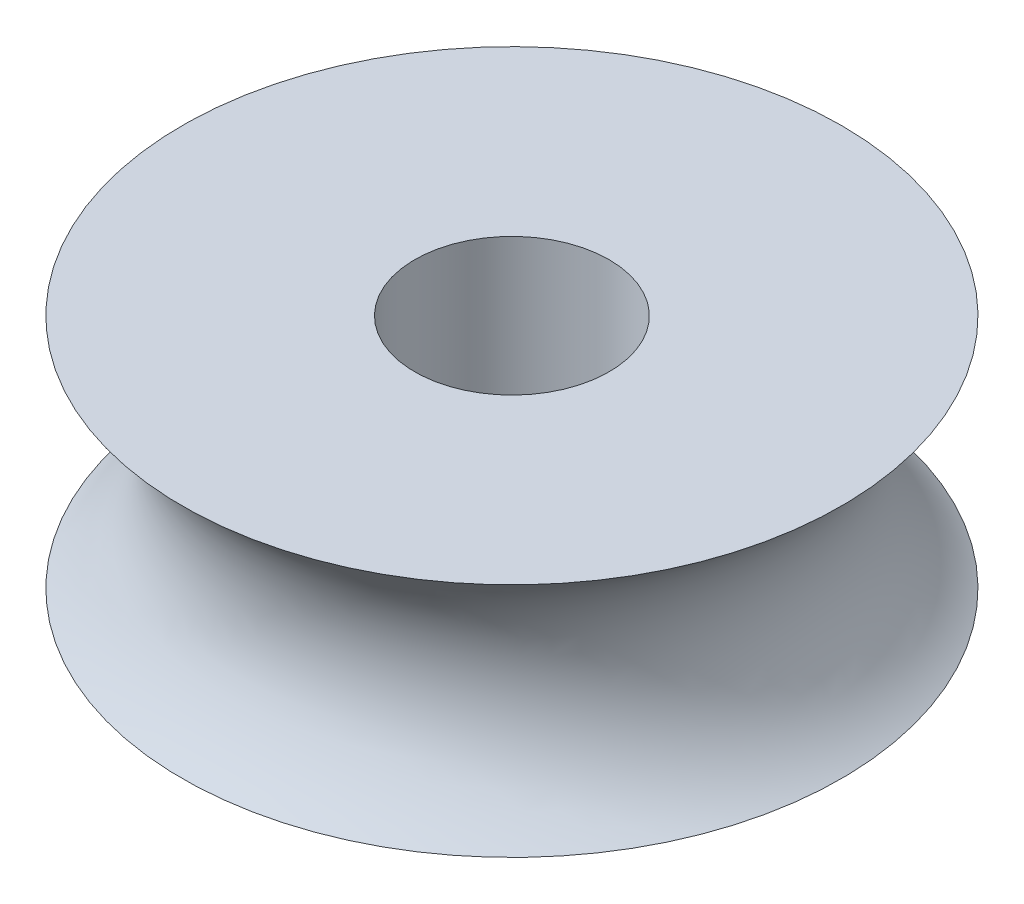
from build123d import *


with BuildPart() as part:
    # Sketch1 → Revolve1 (revolve)
    with BuildSketch(Plane.XY):
        with BuildLine():
            Line((3.5, 8.5), (3.5, 0))
            Line((3.5, 0), (11.866086562, 0))
            ThreePointArc((11.866086562, 0), (9.5, 4.25), (11.866086562, 8.5))
            Line((11.866086562, 8.5), (3.5, 8.5))
        make_face()
    revolve(axis=Axis((0, 0, 0), (0, 1, 0)))


solid = part.part
